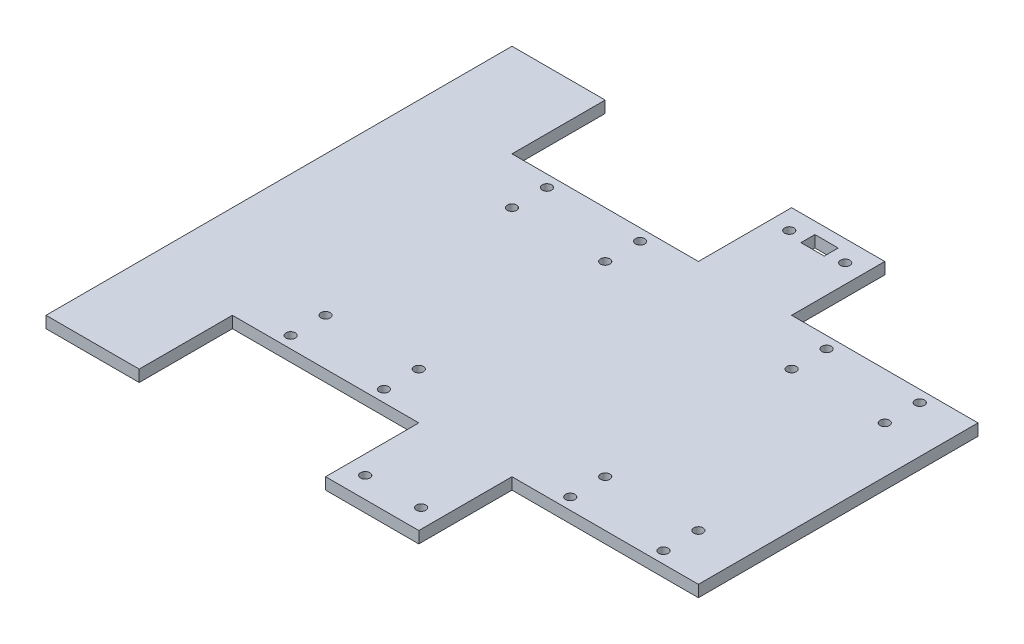
from build123d import *

# Parameters (mm, degrees)
BOSS_EXTRUDE1_DEPTH = 6.35
SKETCH2_W           = 12.7
SKETCH2_H           = 7.62
CUT_EXTRUDE1_DEPTH  = 326.340686819
SKETCH3_R           = 2.54
CUT_EXTRUDE2_DEPTH  = 326.340686819


with BuildPart() as part:
    # Sketch1 → Boss-Extrude1 (new body)
    with BuildSketch(Plane(origin=(0, 0, 0), x_dir=(1, 0, 0), z_dir=(0, 1, 0))):
        Polygon((0, 152.4), (101.6, 152.4), (101.6, 203.2), (152.4, 203.2), (152.4, 152.4), (254, 152.4), (254, 0), (152.4, 0), (152.4, -50.8), (101.6, -50.8), (101.6, 0), (0, 0), (0, -50.8), (-50.8, -50.8), (-50.8, 203.2), (0, 203.2), align=None)
    extrude(amount=BOSS_EXTRUDE1_DEPTH)

    # Sketch2 → Cut-Extrude1 (cut, through all)
    with BuildSketch(Plane(origin=(0, 6.35, 0), x_dir=(1, 0, 0), z_dir=(0, 1, 0))):
        with Locations((127, 193.04)):
            Rectangle(SKETCH2_W, SKETCH2_H)
    extrude(amount=-CUT_EXTRUDE1_DEPTH, mode=Mode.SUBTRACT)

    # Sketch3 → Cut-Extrude2 (cut, through all)
    with BuildSketch(Plane.XZ):
        with Locations((228.6, -146.05)):
            Circle(SKETCH3_R)
        with Locations((177.8, -146.05)):
            Circle(SKETCH3_R)
        with Locations((228.6, -127)):
            Circle(SKETCH3_R)
        with Locations((177.8, -127)):
            Circle(SKETCH3_R)
        with Locations((177.8, -25.4)):
            Circle(SKETCH3_R)
        with Locations((228.6, -25.4)):
            Circle(SKETCH3_R)
        with Locations((177.8, -6.35)):
            Circle(SKETCH3_R)
        with Locations((228.6, -6.35)):
            Circle(SKETCH3_R)
        with Locations((25.4, -6.35)):
            Circle(SKETCH3_R)
        with Locations((76.2, -6.35)):
            Circle(SKETCH3_R)
        with Locations((25.4, -25.4)):
            Circle(SKETCH3_R)
        with Locations((76.2, -25.4)):
            Circle(SKETCH3_R)
        with Locations((76.2, -127)):
            Circle(SKETCH3_R)
        with Locations((25.4, -127)):
            Circle(SKETCH3_R)
        with Locations((76.2, -146.05)):
            Circle(SKETCH3_R)
        with Locations((25.4, -146.05)):
            Circle(SKETCH3_R)
        with Locations((142.24, -191.77)):
            Circle(SKETCH3_R)
        with Locations((111.76, -191.77)):
            Circle(SKETCH3_R)
        with Locations((142.24, 39.37)):
            Circle(SKETCH3_R)
        with Locations((111.76, 39.37)):
            Circle(SKETCH3_R)
    extrude(amount=-CUT_EXTRUDE2_DEPTH, mode=Mode.SUBTRACT)


solid = part.part
